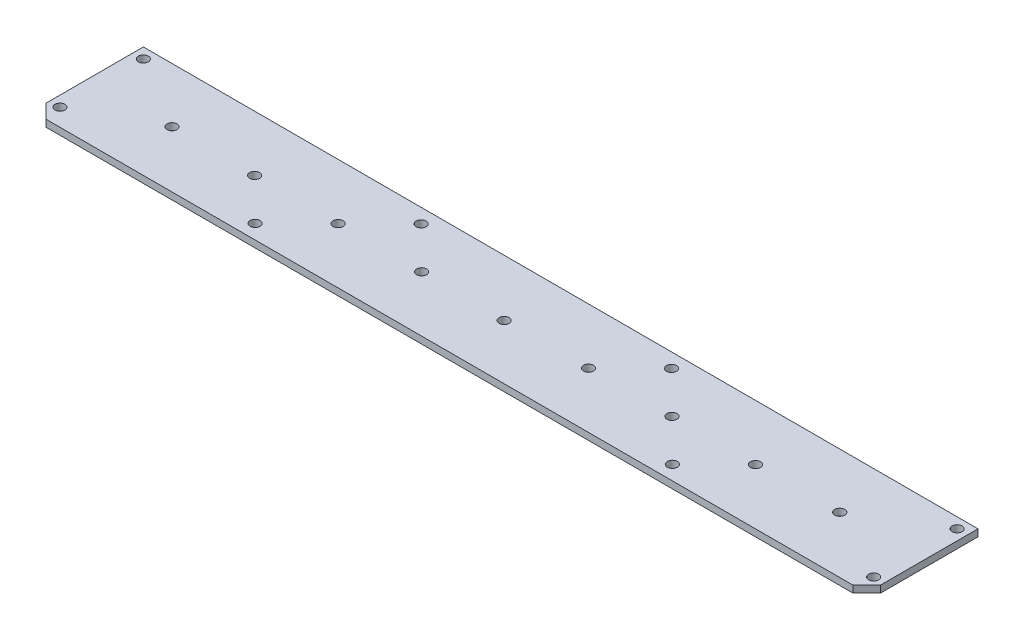
from build123d import *

# Parameters (mm, degrees)
SKETCH2_W           = 381
SKETCH2_H           = 50.8
BOSS_EXTRUDE1_DEPTH = 3.175
CUT_EXTRUDE1_REACH  = 386.385
SKETCH3_R           = 2.286


with BuildPart() as part:
    # Sketch2 → Boss-Extrude1 (new body)
    with BuildSketch(Plane(origin=(0, 0, 0), x_dir=(1, 0, 0), z_dir=(0, 1, 0))):
        with Locations((190.5, 25.4)):
            Rectangle(SKETCH2_W, SKETCH2_H)
    extrude(amount=BOSS_EXTRUDE1_DEPTH)

    # Sketch3 → Cut-Extrude1 (cut, up to next)
    with BuildSketch(Plane(origin=(0, 3.175, 0), x_dir=(1, 0, 0), z_dir=(0, 1, 0)), mode=Mode.PRIVATE) as cut_extrude1_sk1:
        with Locations((190.5, 25.003125)):
            Circle(SKETCH3_R)
    cut_extrude1_tool1 = extrude(cut_extrude1_sk1.sketch, amount=-CUT_EXTRUDE1_REACH, mode=Mode.PRIVATE) & part.part
    # Sketch3 → Cut-Extrude1 (cut, up to next)
    with BuildSketch(Plane(origin=(0, 3.175, 0), x_dir=(1, 0, 0), z_dir=(0, 1, 0)), mode=Mode.PRIVATE) as cut_extrude1_sk2:
        with Locations((38.1, 25.796875)):
            Circle(SKETCH3_R)
    cut_extrude1_tool2 = extrude(cut_extrude1_sk2.sketch, amount=-CUT_EXTRUDE1_REACH, mode=Mode.PRIVATE) & part.part
    # Sketch3 → Cut-Extrude1 (cut, up to next)
    with BuildSketch(Plane(origin=(0, 3.175, 0), x_dir=(1, 0, 0), z_dir=(0, 1, 0)), mode=Mode.PRIVATE) as cut_extrude1_sk3:
        with Locations((114.3, 25.4)):
            Circle(SKETCH3_R)
    cut_extrude1_tool3 = extrude(cut_extrude1_sk3.sketch, amount=-CUT_EXTRUDE1_REACH, mode=Mode.PRIVATE) & part.part
    # Sketch3 → Cut-Extrude1 (cut, up to next)
    with BuildSketch(Plane(origin=(0, 3.175, 0), x_dir=(1, 0, 0), z_dir=(0, 1, 0)), mode=Mode.PRIVATE) as cut_extrude1_sk4:
        with Locations((76.2, 25.4)):
            Circle(SKETCH3_R)
    cut_extrude1_tool4 = extrude(cut_extrude1_sk4.sketch, amount=-CUT_EXTRUDE1_REACH, mode=Mode.PRIVATE) & part.part
    # Sketch3 → Cut-Extrude1 (cut, up to next)
    with BuildSketch(Plane(origin=(0, 3.175, 0), x_dir=(1, 0, 0), z_dir=(0, 1, 0)), mode=Mode.PRIVATE) as cut_extrude1_sk5:
        with Locations((152.4, 25.4)):
            Circle(SKETCH3_R)
    cut_extrude1_tool5 = extrude(cut_extrude1_sk5.sketch, amount=-CUT_EXTRUDE1_REACH, mode=Mode.PRIVATE) & part.part
    # Sketch3 → Cut-Extrude1 (cut, up to next)
    with BuildSketch(Plane(origin=(0, 3.175, 0), x_dir=(1, 0, 0), z_dir=(0, 1, 0)), mode=Mode.PRIVATE) as cut_extrude1_sk6:
        with Locations((228.6, 25.4)):
            Circle(SKETCH3_R)
    cut_extrude1_tool6 = extrude(cut_extrude1_sk6.sketch, amount=-CUT_EXTRUDE1_REACH, mode=Mode.PRIVATE) & part.part
    # Sketch3 → Cut-Extrude1 (cut, up to next)
    with BuildSketch(Plane(origin=(0, 3.175, 0), x_dir=(1, 0, 0), z_dir=(0, 1, 0)), mode=Mode.PRIVATE) as cut_extrude1_sk7:
        with Locations((304.8, 25.4)):
            Circle(SKETCH3_R)
    cut_extrude1_tool7 = extrude(cut_extrude1_sk7.sketch, amount=-CUT_EXTRUDE1_REACH, mode=Mode.PRIVATE) & part.part
    # Sketch3 → Cut-Extrude1 (cut, up to next)
    with BuildSketch(Plane(origin=(0, 3.175, 0), x_dir=(1, 0, 0), z_dir=(0, 1, 0)), mode=Mode.PRIVATE) as cut_extrude1_sk8:
        with Locations((266.7, 25.4)):
            Circle(SKETCH3_R)
    cut_extrude1_tool8 = extrude(cut_extrude1_sk8.sketch, amount=-CUT_EXTRUDE1_REACH, mode=Mode.PRIVATE) & part.part
    # Sketch3 → Cut-Extrude1 (cut, up to next)
    with BuildSketch(Plane(origin=(0, 3.175, 0), x_dir=(1, 0, 0), z_dir=(0, 1, 0)), mode=Mode.PRIVATE) as cut_extrude1_sk9:
        with Locations((342.9, 25.796875)):
            Circle(SKETCH3_R)
    cut_extrude1_tool9 = extrude(cut_extrude1_sk9.sketch, amount=-CUT_EXTRUDE1_REACH, mode=Mode.PRIVATE) & part.part
    # Sketch3 → Cut-Extrude1 (cut, up to next)
    with BuildSketch(Plane(origin=(0, 3.175, 0), x_dir=(1, 0, 0), z_dir=(0, 1, 0)), mode=Mode.PRIVATE) as cut_extrude1_sk10:
        with Locations((247.65, 44.252590674)):
            Circle(SKETCH3_R)
    cut_extrude1_tool10 = extrude(cut_extrude1_sk10.sketch, amount=-CUT_EXTRUDE1_REACH, mode=Mode.PRIVATE) & part.part
    # Sketch3 → Cut-Extrude1 (cut, up to next)
    with BuildSketch(Plane(origin=(0, 3.175, 0), x_dir=(1, 0, 0), z_dir=(0, 1, 0)), mode=Mode.PRIVATE) as cut_extrude1_sk11:
        with Locations((285.75, 6.547409326)):
            Circle(SKETCH3_R)
    cut_extrude1_tool11 = extrude(cut_extrude1_sk11.sketch, amount=-CUT_EXTRUDE1_REACH, mode=Mode.PRIVATE) & part.part
    # Sketch3 → Cut-Extrude1 (cut, up to next)
    with BuildSketch(Plane(origin=(0, 3.175, 0), x_dir=(1, 0, 0), z_dir=(0, 1, 0)), mode=Mode.PRIVATE) as cut_extrude1_sk12:
        with Locations((95.25, 6.547409326)):
            Circle(SKETCH3_R)
    cut_extrude1_tool12 = extrude(cut_extrude1_sk12.sketch, amount=-CUT_EXTRUDE1_REACH, mode=Mode.PRIVATE) & part.part
    # Sketch3 → Cut-Extrude1 (cut, up to next)
    with BuildSketch(Plane(origin=(0, 3.175, 0), x_dir=(1, 0, 0), z_dir=(0, 1, 0)), mode=Mode.PRIVATE) as cut_extrude1_sk13:
        with Locations((133.35, 44.252590674)):
            Circle(SKETCH3_R)
    cut_extrude1_tool13 = extrude(cut_extrude1_sk13.sketch, amount=-CUT_EXTRUDE1_REACH, mode=Mode.PRIVATE) & part.part
    # Sketch3 → Cut-Extrude1 (cut, up to next)
    with BuildSketch(Plane(origin=(0, 3.175, 0), x_dir=(1, 0, 0), z_dir=(0, 1, 0)), mode=Mode.PRIVATE) as cut_extrude1_sk14:
        with Locations((4.7625, 46.0375)):
            Circle(SKETCH3_R)
    cut_extrude1_tool14 = extrude(cut_extrude1_sk14.sketch, amount=-CUT_EXTRUDE1_REACH, mode=Mode.PRIVATE) & part.part
    # Sketch3 → Cut-Extrude1 (cut, up to next)
    with BuildSketch(Plane(origin=(0, 3.175, 0), x_dir=(1, 0, 0), z_dir=(0, 1, 0)), mode=Mode.PRIVATE) as cut_extrude1_sk15:
        with Locations((4.7625, 7.9375)):
            Circle(SKETCH3_R)
    cut_extrude1_tool15 = extrude(cut_extrude1_sk15.sketch, amount=-CUT_EXTRUDE1_REACH, mode=Mode.PRIVATE) & part.part
    # Sketch3 → Cut-Extrude1 (cut, up to next)
    with BuildSketch(Plane(origin=(0, 3.175, 0), x_dir=(1, 0, 0), z_dir=(0, 1, 0)), mode=Mode.PRIVATE) as cut_extrude1_sk16:
        with Locations((376.2375, 7.9375)):
            Circle(SKETCH3_R)
    cut_extrude1_tool16 = extrude(cut_extrude1_sk16.sketch, amount=-CUT_EXTRUDE1_REACH, mode=Mode.PRIVATE) & part.part
    # Sketch3 → Cut-Extrude1 (cut, up to next)
    with BuildSketch(Plane(origin=(0, 3.175, 0), x_dir=(1, 0, 0), z_dir=(0, 1, 0)), mode=Mode.PRIVATE) as cut_extrude1_sk17:
        with Locations((376.2375, 46.0375)):
            Circle(SKETCH3_R)
    cut_extrude1_tool17 = extrude(cut_extrude1_sk17.sketch, amount=-CUT_EXTRUDE1_REACH, mode=Mode.PRIVATE) & part.part
    # Sketch3 → Cut-Extrude1 (cut, up to next)
    with BuildSketch(Plane(origin=(0, 3.175, 0), x_dir=(1, 0, 0), z_dir=(0, 1, 0)), mode=Mode.PRIVATE) as cut_extrude1_sk18:
        Polygon((0, 6.35), (6.35, 0), (0, 0), align=None)
    cut_extrude1_tool18 = extrude(cut_extrude1_sk18.sketch, amount=-CUT_EXTRUDE1_REACH, mode=Mode.PRIVATE) & part.part
    # Sketch3 → Cut-Extrude1 (cut, up to next)
    with BuildSketch(Plane(origin=(0, 3.175, 0), x_dir=(1, 0, 0), z_dir=(0, 1, 0)), mode=Mode.PRIVATE) as cut_extrude1_sk19:
        Polygon((374.65, 0), (381, 0), (381, 6.35), align=None)
    cut_extrude1_tool19 = extrude(cut_extrude1_sk19.sketch, amount=-CUT_EXTRUDE1_REACH, mode=Mode.PRIVATE) & part.part
    add(cut_extrude1_tool1.solids().sort_by_distance((190.5, 3.175, -25.003125))[0], mode=Mode.SUBTRACT)
    add(cut_extrude1_tool2.solids().sort_by_distance((38.1, 3.175, -25.796875))[0], mode=Mode.SUBTRACT)
    add(cut_extrude1_tool3.solids().sort_by_distance((114.3, 3.175, -25.4))[0], mode=Mode.SUBTRACT)
    add(cut_extrude1_tool4.solids().sort_by_distance((76.2, 3.175, -25.4))[0], mode=Mode.SUBTRACT)
    add(cut_extrude1_tool5.solids().sort_by_distance((152.4, 3.175, -25.4))[0], mode=Mode.SUBTRACT)
    add(cut_extrude1_tool6.solids().sort_by_distance((228.6, 3.175, -25.4))[0], mode=Mode.SUBTRACT)
    add(cut_extrude1_tool7.solids().sort_by_distance((304.8, 3.175, -25.4))[0], mode=Mode.SUBTRACT)
    add(cut_extrude1_tool8.solids().sort_by_distance((266.7, 3.175, -25.4))[0], mode=Mode.SUBTRACT)
    add(cut_extrude1_tool9.solids().sort_by_distance((342.9, 3.175, -25.796875))[0], mode=Mode.SUBTRACT)
    add(cut_extrude1_tool10.solids().sort_by_distance((247.65, 3.175, -44.252591))[0], mode=Mode.SUBTRACT)
    add(cut_extrude1_tool11.solids().sort_by_distance((285.75, 3.175, -6.547409))[0], mode=Mode.SUBTRACT)
    add(cut_extrude1_tool12.solids().sort_by_distance((95.25, 3.175, -6.547409))[0], mode=Mode.SUBTRACT)
    add(cut_extrude1_tool13.solids().sort_by_distance((133.35, 3.175, -44.252591))[0], mode=Mode.SUBTRACT)
    add(cut_extrude1_tool14.solids().sort_by_distance((4.7625, 3.175, -46.0375))[0], mode=Mode.SUBTRACT)
    add(cut_extrude1_tool15.solids().sort_by_distance((4.7625, 3.175, -7.9375))[0], mode=Mode.SUBTRACT)
    add(cut_extrude1_tool16.solids().sort_by_distance((376.2375, 3.175, -7.9375))[0], mode=Mode.SUBTRACT)
    add(cut_extrude1_tool17.solids().sort_by_distance((376.2375, 3.175, -46.0375))[0], mode=Mode.SUBTRACT)
    add(cut_extrude1_tool18.solids().sort_by_distance((2.116667, 3.175, -2.116667))[0], mode=Mode.SUBTRACT)
    add(cut_extrude1_tool19.solids().sort_by_distance((378.883333, 3.175, -2.116667))[0], mode=Mode.SUBTRACT)


solid = part.part
